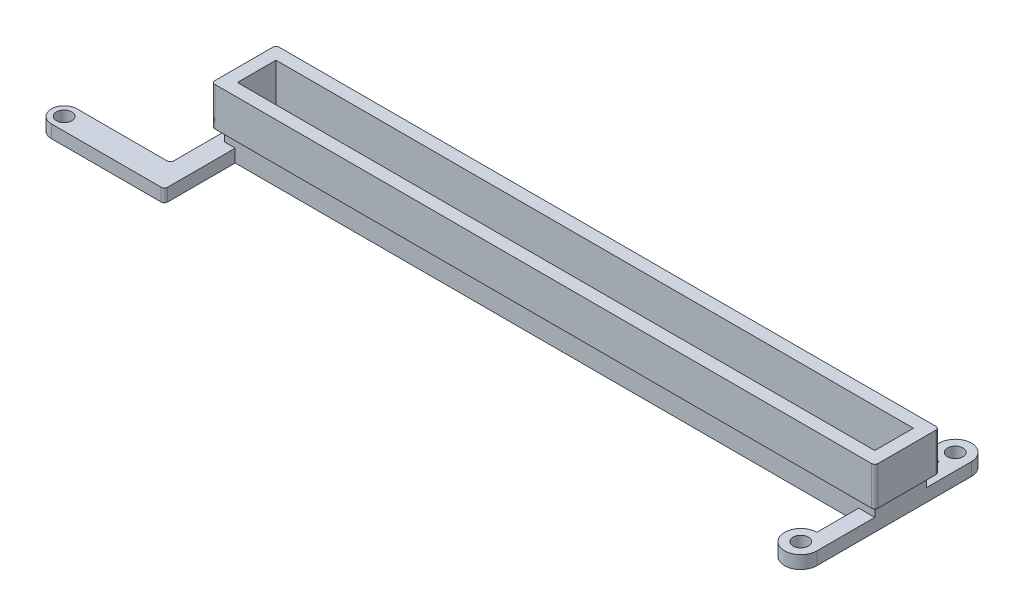
from build123d import *

# Parameters (mm, degrees)
SKETCH1_W           = 101
SKETCH1_H           = 8
SKETCH1_W_2         = 99
SKETCH1_H_2         = 6
BOSS_EXTRUDE1_DEPTH = 10
SKETCH2_R           = 1.2
BOSS_EXTRUDE2_DEPTH = 2
SKETCH3_W           = 103
SKETCH3_H           = 10
SKETCH3_W_2         = 101
SKETCH3_H_2         = 8
BOSS_EXTRUDE3_DEPTH = 6
FILLET4_R           = 1
FILLET5_R           = 1
FILLET6_R           = 1
FILLET7_R           = 1
FILLET8_R           = 0.5
FILLET9_R           = 0.5


# Some blends are built 0.0001 mm under size
with BuildPart() as part:
    # Sketch1 → Boss-Extrude1 (new body)
    with BuildSketch(Plane(origin=(0, 0, 0), x_dir=(1, 0, 0), z_dir=(0, 1, 0))):
        Rectangle(SKETCH1_W, SKETCH1_H)
        Rectangle(SKETCH1_W_2, SKETCH1_H_2, mode=Mode.SUBTRACT)
    extrude(amount=BOSS_EXTRUDE1_DEPTH)

    # Sketch2 → Boss-Extrude2 (add)
    # profile 1 of 3: a face of its own
    with BuildSketch(Plane.XZ):
        with BuildLine():
            Line((48, 4), (50.5, 4))
            Line((50.5, 4), (50.5, 13))
            ThreePointArc((50.5, 13), (46.232233047, 14.767766953), (48, 10.5))
            Line((48, 10.5), (48, 4))
        make_face()
        with Locations(Location((48, 13, 0), (0, 0, 270))):
            Circle(SKETCH2_R, mode=Mode.SUBTRACT)
    # profile 2 of 3: a face of its own
    with BuildSketch(Plane.XZ):
        with BuildLine():
            Line((48, -4), (50.5, -4))
            Line((50.5, -4), (50.5, -11))
            ThreePointArc((50.5, -11), (46.232233047, -12.767766953), (48, -8.5))
            Line((48, -8.5), (48, -4))
        make_face()
        with Locations(Location((48, -11, 0), (0, 0, 270))):
            Circle(SKETCH2_R, mode=Mode.SUBTRACT)
    # profile 3 of 3: a face of its own
    with BuildSketch(Plane.XZ):
        with BuildLine():
            Line((-66.4, 15), (-48.835058433, 15))
            Line((-48.835058433, 15), (-48.835058433, 4))
            Line((-48.835058433, 4), (-50.5, 4))
            Line((-50.5, 4), (-50.5, -4))
            Line((-50.5, -4), (-51.901659191, -4))
            Line((-51.901659191, -4), (-51.901659191, 11))
            Line((-51.901659191, 11), (-66.4, 11))
            ThreePointArc((-66.4, 11), (-68.4, 13), (-66.4, 15))
        make_face()
        with Locations(Location((-66.4, 13, 0), (0, 0, 270))):
            Circle(SKETCH2_R, mode=Mode.SUBTRACT)
    extrude(amount=-BOSS_EXTRUDE2_DEPTH)

    # Sketch3 → Boss-Extrude3 (add)
    with BuildSketch(Plane(origin=(0, 10, 0), x_dir=(1, 0, 0), z_dir=(0, 1, 0))):
        Rectangle(SKETCH3_W, SKETCH3_H)
        Rectangle(SKETCH3_W_2, SKETCH3_H_2, mode=Mode.SUBTRACT)
    extrude(amount=-BOSS_EXTRUDE3_DEPTH)

    # Fillet4
    fillet4_edges = [part.edges().sort_by_distance(p)[0] for p in [
        (0, 4, -4),
    ]]
    fillet(fillet4_edges, radius=FILLET4_R - 0.0001)  # a hair under: the kernel refuses the full size

    # Fillet5
    fillet5_edges = [part.edges().sort_by_distance(p)[0] for p in [
        (0, 4, 4),
    ]]
    fillet(fillet5_edges, radius=FILLET5_R - 0.0001)  # a hair under: the kernel refuses the full size

    # Fillet6
    fillet6_edges = [part.edges().sort_by_distance(p)[0] for p in [
        (50.5, 4, 0),
    ]]
    fillet(fillet6_edges, radius=FILLET6_R - 0.0001)  # a hair under: the kernel refuses the full size

    # Fillet7
    fillet7_edges = [part.edges().sort_by_distance(p)[0] for p in [
        (-50.5, 4, 0),
    ]]
    fillet(fillet7_edges, radius=FILLET7_R - 0.0001)  # a hair under: the kernel refuses the full size

    # Fillet8
    fillet8_edges = [part.edges().sort_by_distance(p)[0] for p in [
        (-51.901659191, 1, 11),
        (-48.835058433, 1, 15),
    ]]
    fillet(fillet8_edges, radius=FILLET8_R)

    # Fillet9
    # the kernel refuses this fillet: 0.5 mm, written as the material it takes off along each edge
    with BuildSketch(Plane(origin=(51.5, 11.25, -5), x_dir=(-1, 0, 0), z_dir=(0, -1, 0))) as fillet9_piece_1:
        with BuildLine():
            CenterArc((FILLET9_R, -FILLET9_R), FILLET9_R, 90, 90)
            Line((0, -FILLET9_R), (0, 0))
            Line((0, 0), (FILLET9_R, 0))
        make_face()
    extrude(amount=8.5, mode=Mode.SUBTRACT)
    with BuildSketch(Plane(origin=(51.5, 11.25, 5), x_dir=(-1, 0, 0), z_dir=(0, -1, 0)), Plane(origin=(-51.5, 11.25, 5), x_dir=(0, 0, -1), z_dir=(0, -1, 0)), Plane(origin=(-51.5, 11.25, -5), x_dir=(1, 0, 0), z_dir=(0, -1, 0))) as fillet9_piece_2:
        with BuildLine():
            CenterArc((FILLET9_R, FILLET9_R), FILLET9_R, 180, 90)
            Line((0, FILLET9_R), (0, 0))
            Line((0, 0), (FILLET9_R, 0))
        make_face()
    extrude(amount=8.5, mode=Mode.SUBTRACT)


solid = part.part
